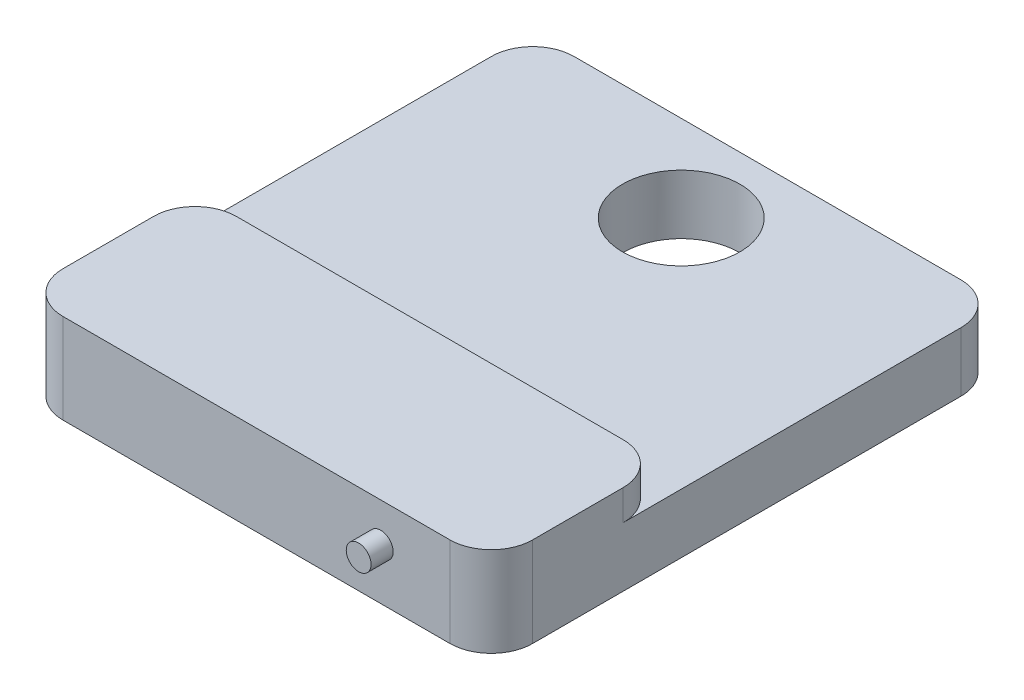
from build123d import *

# Parameters (mm, degrees)
SKETCH1_W           = 215.9
SKETCH1_H           = 234.95
BOSS_EXTRUDE1_DEPTH = 41.275
FILLET1_R           = 19.05
CUT_EXTRUDE1_REACH  = 323.742
SKETCH3_R           = 26.9875
CUT_EXTRUDE2_DEPTH  = 13.97
FILLET2_R           = 19.05
SKETCH5_R           = 5.715
BOSS_EXTRUDE2_DEPTH = 10.16


with BuildPart() as part:
    # Sketch1 → Boss-Extrude1 (new body)
    with BuildSketch(Plane(origin=(0, 0, 0), x_dir=(1, 0, 0), z_dir=(0, 1, 0))):
        with Locations((107.95, 117.475)):
            Rectangle(SKETCH1_W, SKETCH1_H)
    extrude(amount=BOSS_EXTRUDE1_DEPTH)

    # Fillet1
    fillet1_edges = [part.edges().sort_by_distance(p)[0] for p in [
        (0, 20.6375, -234.95),
        (215.9, 20.6375, -234.95),
        (215.9, 20.6375, 0),
        (0, 20.6375, 0),
    ]]
    fillet(fillet1_edges, radius=FILLET1_R)

    # Sketch3 → Cut-Extrude1 (cut, up to next)
    with BuildSketch(Plane(origin=(0, 41.275, 0), x_dir=(1, 0, 0), z_dir=(0, 1, 0)), mode=Mode.PRIVATE) as cut_extrude1_sk1:
        with Locations((107.95, 195.2625)):
            Circle(SKETCH3_R)
    cut_extrude1_tool1 = extrude(cut_extrude1_sk1.sketch, amount=-CUT_EXTRUDE1_REACH, mode=Mode.PRIVATE) & part.part
    add(cut_extrude1_tool1.solids().sort_by_distance((107.95, 41.275, -195.2625))[0], mode=Mode.SUBTRACT)

    # Sketch4 → Cut-Extrude2 (cut)
    with BuildSketch(Plane(origin=(0, 41.275, 0), x_dir=(1, 0, 0), z_dir=(0, 1, 0))):
        with BuildLine():
            Line((215.9, 79.6925), (0, 79.6925))
            Line((0, 79.6925), (0, 215.9))
            ThreePointArc((0, 215.9), (5.579615818, 229.370384182), (19.05, 234.95))
            Line((19.05, 234.95), (196.85, 234.95))
            ThreePointArc((196.85, 234.95), (210.320384182, 229.370384182), (215.9, 215.9))
            Line((215.9, 215.9), (215.9, 79.6925))
        make_face()
    extrude(amount=-CUT_EXTRUDE2_DEPTH, mode=Mode.SUBTRACT)

    # Fillet2
    fillet2_edges = [part.edges().sort_by_distance(p)[0] for p in [
        (0, 34.29, -79.6925),
        (215.9, 34.29, -79.6925),
    ]]
    fillet(fillet2_edges, radius=FILLET2_R)

    # Sketch5 → Boss-Extrude2 (add)
    with BuildSketch(Plane.XY):
        with Locations((165.1, 23.495)):
            Circle(SKETCH5_R)
    extrude(amount=BOSS_EXTRUDE2_DEPTH)


solid = part.part
